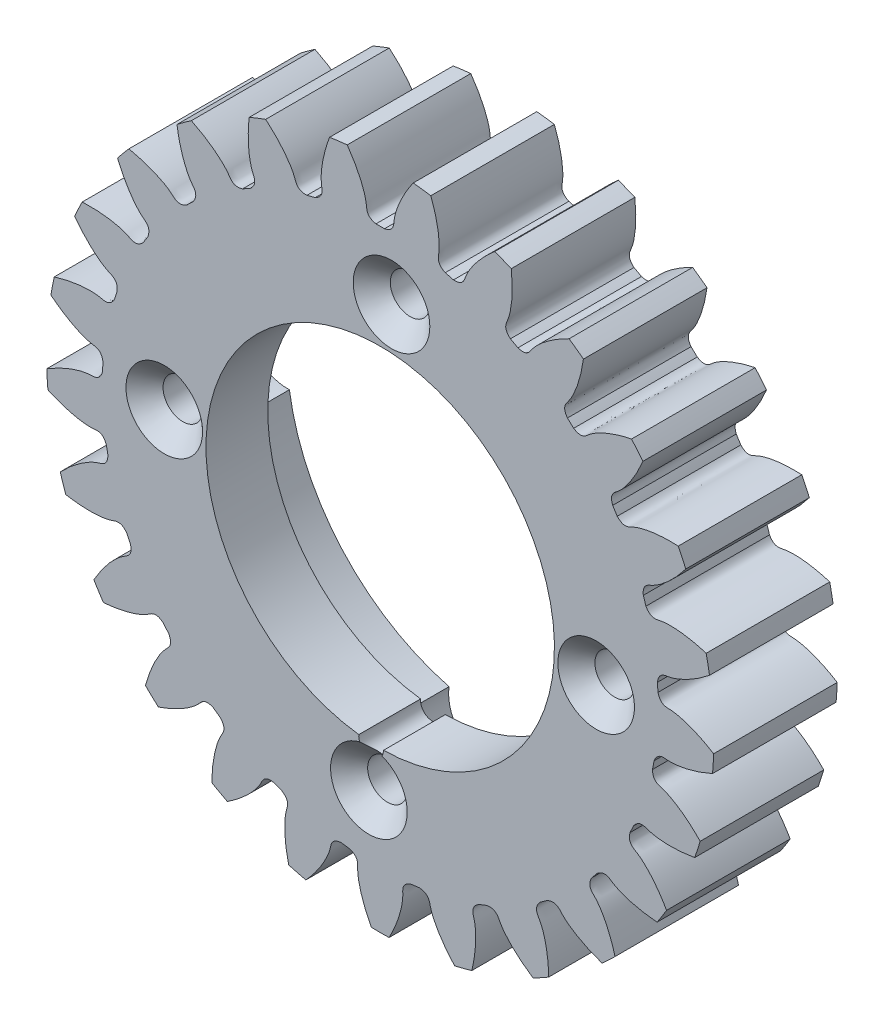
from build123d import *

# Parameters (mm, degrees)
SKETCH_1_R               = 27
EXTRUDE_1_DEPTH          = 10
CUT_EXTRUDE_1_DEPTH      = 40.471508712
PATTERN_CIRCULAR_1_COUNT = 25
SKETCH_4_R               = 1.6
CUT_EXTRUDE_2_DEPTH      = 40.459402209
CUT_EXTRUDE_4_DEPTH      = 5
CHAMFER_1_SIZE           = 1.5


with BuildPart() as part:
    # 草图1 → 凸台-拉伸1 (new body)
    with BuildSketch(Plane.XY):
        Circle(SKETCH_1_R)
    extrude(amount=EXTRUDE_1_DEPTH)

    # 草图2 → 切除-拉伸1 (cut, through all)
    with BuildSketch(Plane.XY):
        with BuildLine():
            ThreePointArc((0.344116975, 22.497368368), (0, 22.5), (-0.344116975, 22.497368368))
            add(Edge.make_bspline(
                [(-0.344116975, 22.497368368), (-1.146679625, 22.670162324), (-1.071015271, 23.15452279), (-1.148390771, 23.63610551), (-1.159242542, 23.696216884), (-1.173152862, 23.765311048), (-1.190471038, 23.843288899), (-1.21156157, 23.930037163), (-1.236779858, 24.025432794), (-1.266479692, 24.129341666), (-1.301010489, 24.241619099), (-1.340717785, 24.362109831), (-1.385942711, 24.490648157), (-1.437021786, 24.627058036), (-1.494286621, 24.771153209), (-1.558063652, 24.922737333), (-1.628673863, 25.081604108), (-1.706432524, 25.247537423), (-1.791648926, 25.420311498), (-1.884626123, 25.599691044), (-1.98566067, 25.785431419), (-2.095042378, 25.977278799), (-2.213054062, 26.174970347), (-2.339971299, 26.378234395), (-2.476062186, 26.586790632), (-2.621587107, 26.800350289), (-2.776798506, 27.018616344), (-2.941940654, 27.241283721), (-3.117249438, 27.4680395), (-3.302952138, 27.698563134), (-3.499267222, 27.932526665), (-3.70640414, 28.169594952), (-3.924563124, 28.409425902), (-4.153934996, 28.651670706), (-4.39470098, 28.895974077), (-4.647032523, 29.141974498), (-4.911091109, 29.389304472), (-5.187028119, 29.637590775), (-5.474984573, 29.886454718), (-5.879947889, 30.222532548), (-6.194933099, 30.468186305), (-6.410542951, 30.629668343)],
                knots=[0, 0, 0, 0, 0.130741207, 0.13574479, 0.141658115, 0.148481183, 0.156213993, 0.164856545, 0.174408839, 0.184870876, 0.196242655, 0.208524177, 0.221715441, 0.235816447, 0.250827195, 0.266747686, 0.283577919, 0.301317894, 0.319967612, 0.339527072, 0.359996274, 0.381375219, 0.403663906, 0.426862335, 0.450970507, 0.475988421, 0.501916077, 0.528753476, 0.556500617, 0.5851575, 0.614724126, 0.645200493, 0.676586604, 0.708882456, 0.742088051, 0.776203388, 0.811228468, 0.847163289, 0.884007854, 0.92176216, 1, 1, 1, 1], degree=3))
            ThreePointArc((-6.410542951, 30.629668343), (0, 31.293316279), (6.410542951, 30.629668343))
            add(Edge.make_bspline(
                [(0.344116975, 22.497368368), (1.146679625, 22.670162324), (1.071015271, 23.15452279), (1.148390771, 23.63610551), (1.159242542, 23.696216884), (1.173152862, 23.765311048), (1.190471038, 23.843288899), (1.21156157, 23.930037163), (1.236779858, 24.025432794), (1.266479692, 24.129341666), (1.301010489, 24.241619099), (1.340717785, 24.362109831), (1.385942711, 24.490648157), (1.437021786, 24.627058036), (1.494286621, 24.771153209), (1.558063652, 24.922737333), (1.628673863, 25.081604108), (1.706432524, 25.247537423), (1.791648926, 25.420311498), (1.884626123, 25.599691044), (1.98566067, 25.785431419), (2.095042378, 25.977278799), (2.213054062, 26.174970347), (2.339971299, 26.378234395), (2.476062186, 26.586790632), (2.621587107, 26.800350289), (2.776798506, 27.018616344), (2.941940654, 27.241283721), (3.117249438, 27.4680395), (3.302952138, 27.698563134), (3.499267222, 27.932526665), (3.70640414, 28.169594952), (3.924563124, 28.409425902), (4.153934996, 28.651670706), (4.39470098, 28.895974077), (4.647032523, 29.141974498), (4.911091109, 29.389304472), (5.187028119, 29.637590775), (5.474984573, 29.886454718), (5.879947889, 30.222532548), (6.194933099, 30.468186305), (6.410542951, 30.629668343)],
                knots=[0, 0, 0, 0, 0.130741207, 0.13574479, 0.141658115, 0.148481183, 0.156213993, 0.164856545, 0.174408839, 0.184870876, 0.196242655, 0.208524177, 0.221715441, 0.235816447, 0.250827195, 0.266747686, 0.283577919, 0.301317894, 0.319967612, 0.339527072, 0.359996274, 0.381375219, 0.403663906, 0.426862335, 0.450970507, 0.475988421, 0.501916077, 0.528753476, 0.556500617, 0.5851575, 0.614724126, 0.645200493, 0.676586604, 0.708882456, 0.742088051, 0.776203388, 0.811228468, 0.847163289, 0.884007854, 0.92176216, 1, 1, 1, 1], degree=3))
        make_face()
    cut_extrude_1 = extrude(amount=CUT_EXTRUDE_1_DEPTH, mode=Mode.SUBTRACT)

    # 阵列(圆周)1: 切除-拉伸1 ×25 about axis
    pattern_circular_1_axis = Axis((0, 0, 10), (0, 0, -1))
    for i in range(1, PATTERN_CIRCULAR_1_COUNT):
        add(cut_extrude_1.rotate(pattern_circular_1_axis, i * 360 / PATTERN_CIRCULAR_1_COUNT), mode=Mode.SUBTRACT)

    # 草图4 → 切除-拉伸2 (cut, through all)
    with BuildSketch(Plane.XY.offset(10)):
        with Locations((-0.915879234, -17.476016858)):
            Circle(SKETCH_4_R)
        with Locations((-17.476016858, 0.915879234)):
            Circle(SKETCH_4_R)
        with Locations((0.915879234, 17.476016858)):
            Circle(SKETCH_4_R)
        with Locations((17.476016858, -0.915879234)):
            Circle(SKETCH_4_R)
        with BuildLine():
            ThreePointArc((0.26192036, -14.097567085), (0.737936983, 14.08067644), (-1.734082556, -13.992961005))
            ThreePointArc((-1.734082556, -13.992961005), (-0.790272939, -15.079305975), (0.26192036, -14.097567085))
        make_face()
    extrude(amount=-CUT_EXTRUDE_2_DEPTH, mode=Mode.SUBTRACT)

    # 草图5 → 切除-拉伸4 (cut)
    with BuildSketch(Plane(origin=(0, 0, 0), x_dir=(-1, 0, 0), z_dir=(0, 0, -1))):
        with BuildLine():
            ThreePointArc((-2.631937232, -17.351524613), (1.101671879, -21.021151707), (4.431247408, -16.981358792))
            ThreePointArc((4.431247408, -16.981358792), (13.042191687, -11.743242142), (17.351524613, -2.631937232))
            ThreePointArc((17.351524613, -2.631937232), (21.021151707, 1.101671879), (16.981358792, 4.431247408))
            ThreePointArc((16.981358792, 4.431247408), (11.743242142, 13.042191687), (2.631937232, 17.351524613))
            ThreePointArc((2.631937232, 17.351524613), (-1.101671879, 21.021151707), (-4.431247408, 16.981358792))
            ThreePointArc((-4.431247408, 16.981358792), (-13.042191687, 11.743242142), (-17.351524613, 2.631937232))
            ThreePointArc((-17.351524613, 2.631937232), (-21.021151707, -1.101671879), (-16.981358792, -4.431247408))
            ThreePointArc((-16.981358792, -4.431247408), (-11.743242142, -13.042191687), (-2.631937232, -17.351524613))
        make_face()
    extrude(amount=-CUT_EXTRUDE_4_DEPTH, mode=Mode.SUBTRACT)

    # 倒角1
    # the kernel refuses this chamfer: 1.5 mm, written as the material it takes off along each edge
    with BuildSketch(Plane(origin=(-0.915879234, -17.476016858, 10), x_dir=(1, 0, 0), z_dir=(0, -1, 0))) as chamfer_1_piece_1:
        Polygon((1.6 + CHAMFER_1_SIZE, 0), (1.6, -CHAMFER_1_SIZE), (1.6, 0), align=None)
    revolve(axis=Axis((-0.915879234, -17.476016858, 10), (0, 0, 1)), mode=Mode.SUBTRACT)
    with BuildSketch(Plane(origin=(17.476016858, -0.915879234, 10), x_dir=(1, 0, 0), z_dir=(0, -1, 0))) as chamfer_1_piece_2:
        Polygon((1.6 + CHAMFER_1_SIZE, 0), (1.6, -CHAMFER_1_SIZE), (1.6, 0), align=None)
    revolve(axis=Axis((17.476016858, -0.915879234, 10), (0, 0, 1)), mode=Mode.SUBTRACT)
    with BuildSketch(Plane(origin=(0.915879234, 17.476016858, 10), x_dir=(1, 0, 0), z_dir=(0, -1, 0))) as chamfer_1_piece_3:
        Polygon((1.6 + CHAMFER_1_SIZE, 0), (1.6, -CHAMFER_1_SIZE), (1.6, 0), align=None)
    revolve(axis=Axis((0.915879234, 17.476016858, 10), (0, 0, 1)), mode=Mode.SUBTRACT)
    with BuildSketch(Plane(origin=(-17.476016858, 0.915879234, 10), x_dir=(1, 0, 0), z_dir=(0, -1, 0))) as chamfer_1_piece_4:
        Polygon((1.6 + CHAMFER_1_SIZE, 0), (1.6, -CHAMFER_1_SIZE), (1.6, 0), align=None)
    revolve(axis=Axis((-17.476016858, 0.915879234, 10), (0, 0, 1)), mode=Mode.SUBTRACT)


solid = part.part
